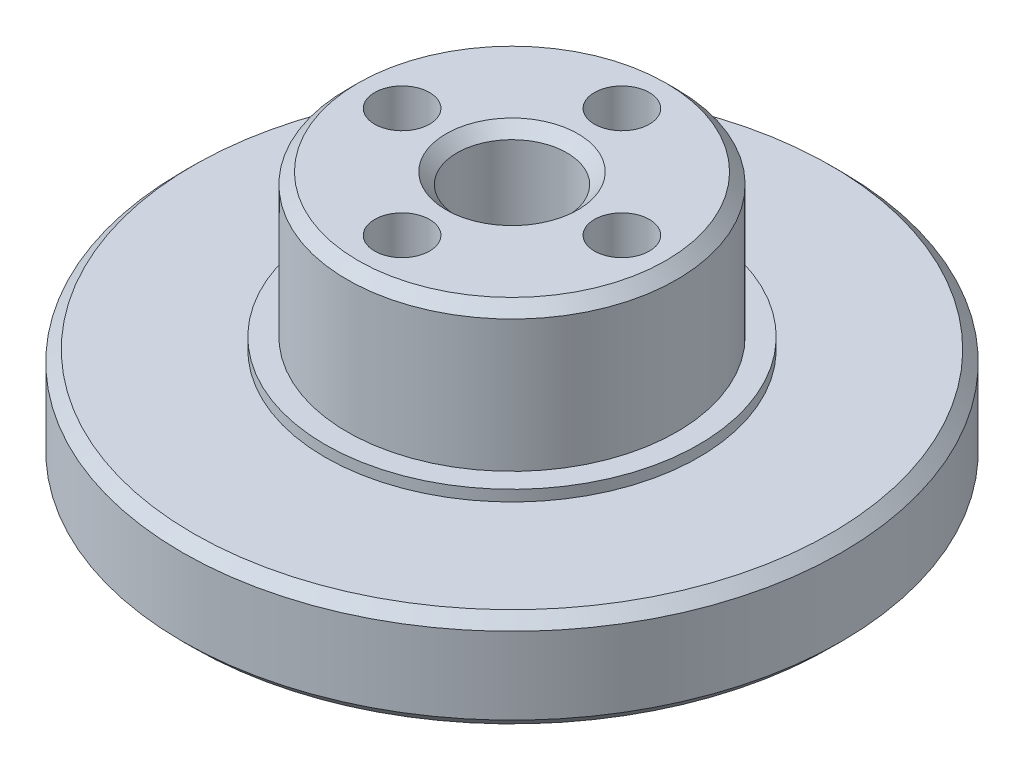
from build123d import *

# Parameters (mm, degrees)
SKETCH_1_R          = 15
SKETCH_1_R_2        = 2
EXTRUDE_1_DEPTH     = 2.5
SKETCH_2_R          = 15
EXTRUDE_2_DEPTH     = 2
SKETCH_3_R          = 8.5
EXTRUDE_3_DEPTH     = 0.5
SKETCH_4_R          = 7.5
EXTRUDE_4_DEPTH     = 6.5
SKETCH_5_R          = 1.25
SKETCH_5_R_2        = 2.5
CUT_EXTRUDE_1_DEPTH = 25.129857024
CHAMFER_1_SIZE      = 0.5


with BuildPart() as part:
    # 草图1 → 凸台-拉伸1 (new body)
    with BuildSketch(Plane(origin=(0, 0, 0), x_dir=(1, 0, 0), z_dir=(0, 1, 0))):
        Circle(SKETCH_1_R)
        with Locations((0, 11.525)):
            Circle(SKETCH_1_R_2, mode=Mode.SUBTRACT)
        with Locations((9.980942779, 5.7625)):
            Circle(SKETCH_1_R_2, mode=Mode.SUBTRACT)
        with Locations((9.980942779, -5.7625)):
            Circle(SKETCH_1_R_2, mode=Mode.SUBTRACT)
        with Locations((0, -11.525)):
            Circle(SKETCH_1_R_2, mode=Mode.SUBTRACT)
        with Locations((-9.980942779, -5.7625)):
            Circle(SKETCH_1_R_2, mode=Mode.SUBTRACT)
        with Locations((-9.980942779, 5.7625)):
            Circle(SKETCH_1_R_2, mode=Mode.SUBTRACT)
    extrude(amount=EXTRUDE_1_DEPTH)

    # 草图2 → 凸台-拉伸2 (add)
    with BuildSketch(Plane(origin=(0, 2.5, 0), x_dir=(1, 0, 0), z_dir=(0, 1, 0))):
        Circle(SKETCH_2_R)
    extrude(amount=EXTRUDE_2_DEPTH)

    # 草图3 → 凸台-拉伸3 (add)
    with BuildSketch(Plane(origin=(0, 4.5, 0), x_dir=(1, 0, 0), z_dir=(0, 1, 0))):
        Circle(SKETCH_3_R)
    extrude(amount=EXTRUDE_3_DEPTH)

    # 草图4 → 凸台-拉伸4 (add)
    with BuildSketch(Plane(origin=(0, 5, 0), x_dir=(1, 0, 0), z_dir=(0, 1, 0))):
        Circle(SKETCH_4_R)
    extrude(amount=EXTRUDE_4_DEPTH)

    # 草图5 → 切除-拉伸1 (cut, through all)
    with BuildSketch(Plane(origin=(0, 11.5, 0), x_dir=(1, 0, 0), z_dir=(0, 1, 0))):
        with Locations((0, 5)):
            Circle(SKETCH_5_R)
        with Locations((5, 0)):
            Circle(SKETCH_5_R)
        with Locations((0, -5)):
            Circle(SKETCH_5_R)
        with Locations((-5, 0)):
            Circle(SKETCH_5_R)
        Circle(SKETCH_5_R_2)
    extrude(amount=-CUT_EXTRUDE_1_DEPTH, mode=Mode.SUBTRACT)

    # 倒角1
    chamfer_1_edges = [part.edges().sort_by_distance(p)[0] for p in [
        (-11.980942779, 0, -5.7625),
        (-11.980942779, 0, 5.7625),
        (-2, 0, 11.525),
        (7.980942779, 0, 5.7625),
        (7.980942779, 0, -5.7625),
        (-2, 0, -11.525),
        (-15, 0, 0),
        (-7.5, 11.5, 0),
        (-15, 4.5, 0),
        (-2.5, 0, 0),
        (3.75, 0, 0),
        (-1.25, 0, 5),
        (-6.25, 0, 0),
        (-1.25, 0, -5),
        (-2.5, 11.5, 0),
    ]]
    chamfer(chamfer_1_edges, length=CHAMFER_1_SIZE)


solid = part.part
